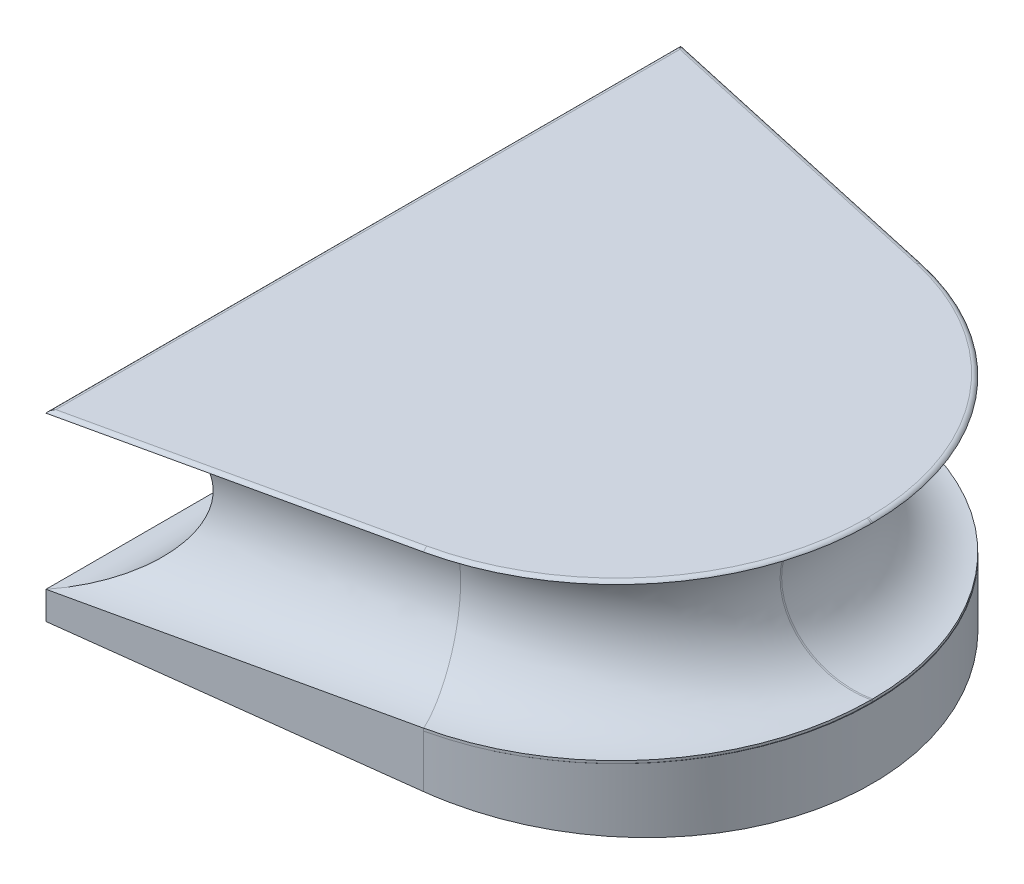
from build123d import *

# Parameters (mm, degrees)
EXTRUDE1_DEPTH = 15.5
SKETCH2_R      = 15
EXTRUDE2_DEPTH = 75
EXTRUDE3_DEPTH = 184.8880846559017
FILLET1_R      = 1


with BuildPart() as part:
    # Sketch1 → Extrude1 (new, symmetric)
    with BuildSketch(Plane(origin=(0, 0, 0), x_dir=(1, 0, 0), z_dir=(0, 1, 0))):
        with BuildLine():
            Line((0, 0), (60.82198069690526, -13.48390849187603))
            ThreePointArc((60.82198069690526, -13.48390849187603), (88.9942241546509, -31.00253523867823), (100, -62.29870884789437))
            Line((100, -62.29870884789437), (99.99999999999987, -62.60210317270317))
            ThreePointArc((99.99999999999987, -62.60210317270317), (88.99422415463724, -93.89827678189278), (60.82198069690526, -111.41690352867806))
            Line((60.82198069690526, -111.41690352867806), (0, -124.90081202055414))
            Line((0, -124.90081202055414), (0, 0))
        make_face()
    extrude(amount=EXTRUDE1_DEPTH, both=True)

    # Cut-Sweep2: sweep along a path in Sketch1<3>
    with BuildLine(Plane(origin=(0, 0, 0), x_dir=(1, 0, 0), z_dir=(0, 1, 0))) as cut_sweep2_path:
        Line((0, 0), (60.82198069690526, -13.48390849187603))
        ThreePointArc((60.82198069690526, -13.48390849187603), (88.9942241546509, -31.00253523867823), (100, -62.29870884789437))
        Line((100, -62.29870884789437), (99.99999999999987, -62.60210317270317))
        ThreePointArc((99.99999999999987, -62.60210317270317), (88.99422415463724, -93.89827678189278), (60.82198069690526, -111.41690352867806))
        Line((60.82198069690526, -111.41690352867806), (0, -124.90081202055414))
        Line((0, -124.90081202055414), (0, 0))
    # Sketch2 → Cut-Sweep2 (sweep, cut)
    with BuildSketch(Plane(origin=(0, 0, 0), x_dir=(0, 0, -1), z_dir=(1, 0, 0))):
        Circle(SKETCH2_R)
    sweep(path=cut_sweep2_path.line, transition=Transition.RIGHT, mode=Mode.SUBTRACT)

    # Sketch6 → Extrude2 (add)
    with BuildSketch(Plane.XZ.offset(15.5)):
        with BuildLine():
            Line((0, 124.90081202055414), (60.82198069690526, 111.41690352867806))
            ThreePointArc((60.82198069690526, 111.41690352867806), (100.12174984458726, 62.45040601027702), (60.82198069690526, 13.48390849187603))
            Line((60.82198069690526, 13.48390849187603), (0, 0))
            Line((0, 0), (0, 124.90081202055414))
        make_face()
    extrude(amount=EXTRUDE2_DEPTH)

    # Sketch7 → Extrude3 (cut, through all)
    with BuildSketch(Plane.XY):
        Polygon((0, -90.5), (-1.415395308e-08, -20.49999999999999), (100.12174984458721, -29.25951808501849), (100.12174984458721, -90.5), align=None)
    extrude(amount=EXTRUDE3_DEPTH, mode=Mode.SUBTRACT)

    # Fillet1
    # the kernel refuses this fillet: 1 mm, written as the material it takes off along each edge
    with BuildSketch(Plane(origin=(100, 15.5, 62.29870884789437), x_dir=(-1, 0, -4.2156e-13), z_dir=(-4.2156e-13, 0, 1))) as fillet1_piece_1:
        with BuildLine():
            CenterArc((0.8660254037844766, 1), FILLET1_R, 209.99999999999892, 60.00000000000108)
            Line((2.842e-14, 0.500000000000016), (-0.01732050807565599, 0.4900000000000162))
            ThreePointArc((-0.01732050807565599, 0.4900000000000162), (-0.01999999999999602, 0.2500000000000071), (-0.01999999999999602, 0))
            Line((-0.01999999999999602, 0), (0, -0.01999999999999957))
            Line((0, -0.01999999999999957), (0.8660254037844766, -0.01999999999999957))
            Line((0.8660254037844766, -0.01999999999999957), (0.8660254037844766, 0))
        make_face()
    extrude(amount=0.30339432480879935, mode=Mode.SUBTRACT)
    with BuildSketch(Plane(origin=(49.999999999999865, 15.5, 62.60210317268144), x_dir=(1, 0, 4.3457e-13), z_dir=(4.3457e-13, 0, -1))) as fillet1_piece_2:
        with BuildLine():
            CenterArc((49.133974596215516, 1), FILLET1_R, 270, 60.000000000001414)
            Line((49.999999999999964, 0.5000000000000231), (50.01732050807565, 0.4900000000000233))
            ThreePointArc((50.01732050807565, 0.4900000000000233), (50.02, 0.25000000000001066), (50.02, 0))
            Line((50.02, 0), (50.00000000000001, -0.01999999999999957))
            Line((50.00000000000001, -0.01999999999999957), (49.133974596215516, -0.01999999999999957))
            Line((49.133974596215516, -0.01999999999999957), (49.133974596215516, 0))
        make_face()
    revolve(axis=Axis((49.999999999999865, 15.5, 62.60210317268144), (0, -1, 0)), revolution_arc=77.4999999999748, mode=Mode.SUBTRACT)
    with BuildSketch(Plane(origin=(60.82198069690526, 15.5, 111.41690352867806), x_dir=(-0.2164396139381069, 0, -0.9762960071199325), z_dir=(-0.9762960071199325, 0, 0.21643961393810693))) as fillet1_piece_3:
        with BuildLine():
            CenterArc((0.8660254037844776, 1), FILLET1_R, 209.99999999999883, 60.00000000000114)
            Line((2.929e-14, 0.5000000000000178), (-0.01732050807566205, 0.490000000000018))
            ThreePointArc((-0.01732050807566205, 0.490000000000018), (-0.02000000000000085, 0.2500000000000089), (-0.01999999999999932, 0))
            Line((-0.01999999999999932, 0), (1.54e-15, -0.01999999999999957))
            Line((1.54e-15, -0.01999999999999957), (0.8660254037844776, -0.01999999999999957))
            Line((0.8660254037844776, -0.01999999999999957), (0.8660254037844776, 0))
        make_face()
    extrude(amount=64.46377235733387, mode=Mode.SUBTRACT)
    with BuildSketch(Plane(origin=(0, 15.5, 127.06587553001535), x_dir=(3.55e-15, -1, 0), z_dir=(0, 0, -1))) as fillet1_piece_4:
        with BuildLine():
            CenterArc((1.000000000000003, -0.8660254037844375), FILLET1_R, 120.0000000000001, 60.000000000000114)
            Line((3.08e-15, -0.866025403784441), (-0.0199999999999965, -0.8660254037844412))
            Line((-0.0199999999999965, -0.8660254037844412), (-0.01999999999999957, -7e-17))
            Line((-0.01999999999999957, -7e-17), (-7e-17, 0.02))
            ThreePointArc((-7e-17, 0.02), (0.24999999999999992, 0.02000000000000089), (0.49000000000000193, 0.01732050807568875))
            Line((0.49000000000000193, 0.01732050807568875), (0.5000000000000018, 0))
        make_face()
    extrude(amount=129.23093903947654, mode=Mode.SUBTRACT)
    with BuildSketch(Plane(origin=(-2.1137428594480574, 15.5, -0.4686055101392677), x_dir=(1.2e-16, -1, -5.3e-16), z_dir=(0.9762960071199327, 0, 0.21643961393810618))) as fillet1_piece_5:
        with BuildLine():
            CenterArc((0.9999999999999996, -0.8660254037844389), FILLET1_R, 119.99999999999997, 60)
            Line((-4.7e-16, -0.8660254037844384), (-0.02000000000000004, -0.8660254037844384))
            Line((-0.02000000000000004, -0.8660254037844384), (-0.01999999999999957, 0))
            Line((-0.01999999999999957, 0), (1e-17, 0.0200000000000001))
            ThreePointArc((1e-17, 0.0200000000000001), (0.25, 0.01999999999999992), (0.4900000000000002, 0.0173205080756887))
            Line((0.4900000000000002, 0.0173205080756887), (0.5, 0))
        make_face()
    extrude(amount=64.46377235733385, mode=Mode.SUBTRACT)
    with BuildSketch(Plane(origin=(49.99999999999996, 15.5, 62.29870884787272), x_dir=(0.21643961393810582, 0, -0.9762960071199328), z_dir=(-0.9762960071199328, 0, -0.21643961393810582))) as fillet1_piece_6:
        with BuildLine():
            CenterArc((49.133974596215566, 1.0000000000000002), FILLET1_R, 270, 60.00000000000153)
            Line((50.00000000000002, 0.5000000000000214), (50.017320508075706, 0.49000000000002164))
            ThreePointArc((50.017320508075706, 0.49000000000002164), (50.02000000000005, 0.2500000000000107), (50.02000000000005, 0))
            Line((50.02000000000005, 0), (50.00000000000005, -0.01999999999999958))
            Line((50.00000000000005, -0.01999999999999958), (49.133974596215566, -0.01999999999999958))
            Line((49.133974596215566, -0.01999999999999958), (49.133974596215566, 0))
        make_face()
    revolve(axis=Axis((49.99999999999996, 15.5, 62.29870884787272), (0, -1, 0)), revolution_arc=77.50000000002464, mode=Mode.SUBTRACT)


solid = part.part
